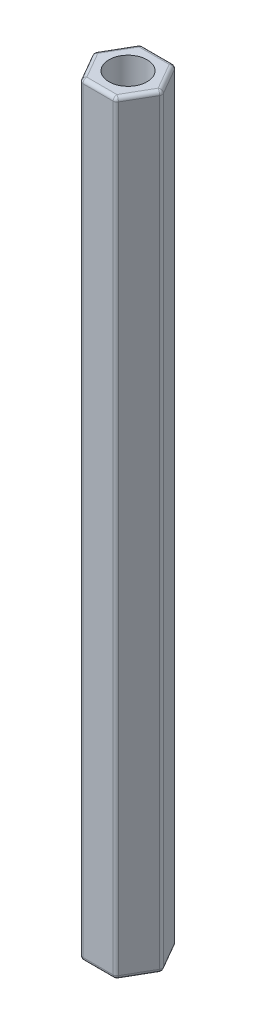
from build123d import *

# Parameters (mm, degrees)
SKETCH_1_R      = 1.5
EXTRUDE_1_DEPTH = 60
FILLET_1_R      = 0.3


with BuildPart() as part:
    # 草图1 → 凸台-拉伸1 (new body)
    with BuildSketch(Plane(origin=(0, 0, 0), x_dir=(1, 0, 0), z_dir=(0, 1, 0))):
        Polygon((2.713546265, 0), (1.356773133, 2.35), (-1.356773133, 2.35), (-2.713546265, 0), (-1.356773133, -2.35), (1.356773133, -2.35), align=None)
        Circle(SKETCH_1_R, mode=Mode.SUBTRACT)
    extrude(amount=EXTRUDE_1_DEPTH)

    # 圆角1
    fillet_1_edges = [part.edges().sort_by_distance(p)[0] for p in [
        (2.713546265, 30, 0),
        (1.356773133, 30, -2.35),
        (-1.356773133, 30, -2.35),
        (-2.713546265, 30, 0),
        (-1.356773133, 30, 2.35),
        (1.356773133, 30, 2.35),
        (0, 60, 2.35),
        (-2.035159699, 60, 1.175),
        (-2.035159699, 60, -1.175),
        (0, 60, -2.35),
        (2.035159699, 60, -1.175),
        (2.035159699, 60, 1.175),
        (0, 0, 2.35),
        (-2.035159699, 0, 1.175),
        (-2.035159699, 0, -1.175),
        (0, 0, -2.35),
        (2.035159699, 0, -1.175),
        (2.035159699, 0, 1.175),
    ]]
    fillet(fillet_1_edges, radius=FILLET_1_R)


solid = part.part
